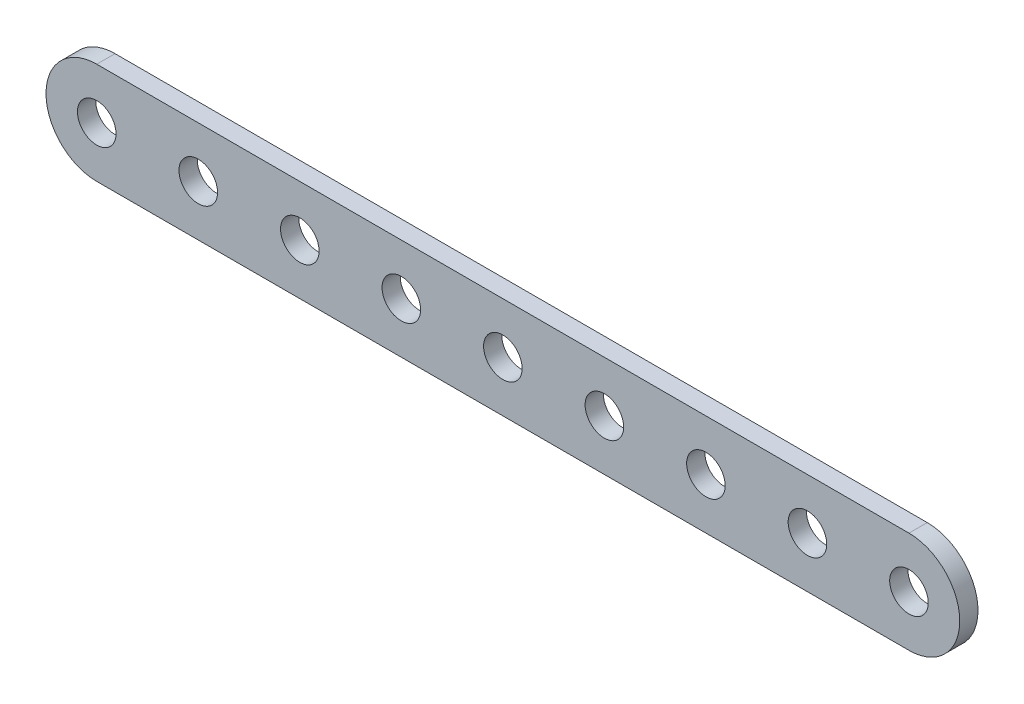
from build123d import *

# Parameters (mm, degrees)
BOSS_EXTRUDE1_DEPTH = 2.286
SKETCH2_R           = 2.413
CUT_EXTRUDE1_DEPTH  = 58.547118051
LPATTERN1_COUNT     = 9
LPATTERN1_PITCH     = 12.7


with BuildPart() as part:
    # Sketch1 → Boss-Extrude1 (new body)
    with BuildSketch(Plane.XY):
        with BuildLine():
            Line((-50.8, 6.35), (50.8, 6.35))
            ThreePointArc((50.8, 6.35), (57.15, 0), (50.8, -6.35))
            Line((50.8, -6.35), (-50.8, -6.35))
            ThreePointArc((-50.8, -6.35), (-57.15, 0), (-50.8, 6.35))
        make_face()
    extrude(amount=BOSS_EXTRUDE1_DEPTH)

    # Sketch2 → Cut-Extrude1 (cut, through all)
    with BuildSketch(Plane.XY.offset(2.286)):
        with Locations((-50.8, 0)):
            Circle(SKETCH2_R)
    cut_extrude1 = extrude(amount=-CUT_EXTRUDE1_DEPTH, mode=Mode.SUBTRACT)

    # LPattern1: Cut-Extrude1 ×9
    with Locations(*[(i * LPATTERN1_PITCH, 0, 0) for i in range(1, LPATTERN1_COUNT)]):
        add(cut_extrude1, mode=Mode.SUBTRACT)


solid = part.part
